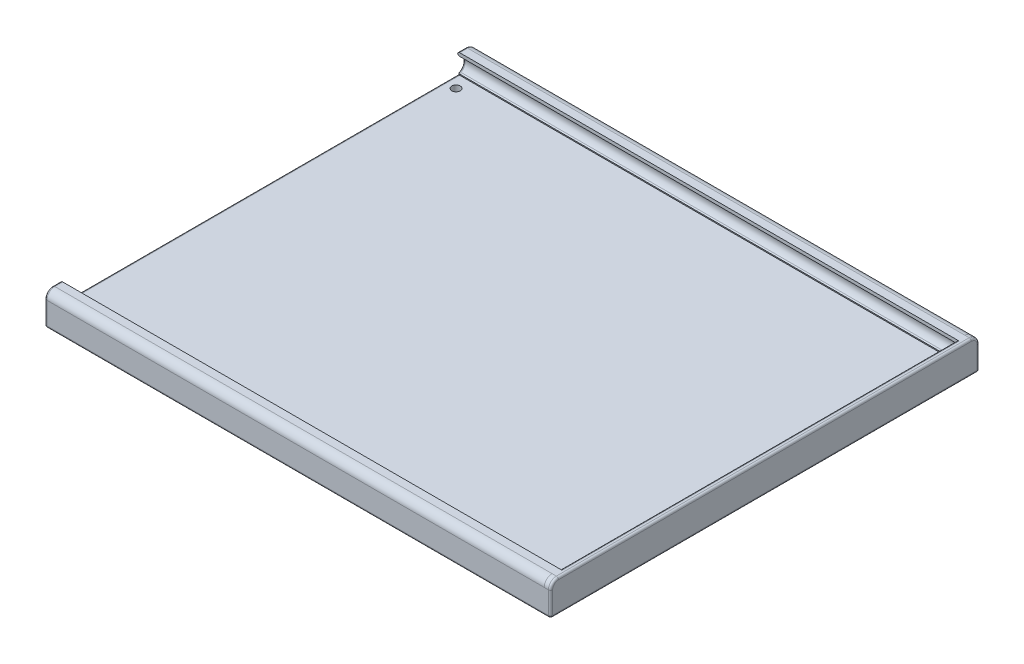
from build123d import *

# Parameters (mm, degrees)
SKETCH_1_W                         = 189.2
SKETCH_1_H                         = 149.2
EXTRUDE_184_4_144_4_24_DEPTH       = 24
SKETCH_2_W                         = 184.4
SKETCH_2_H                         = 144.4
CUT_EXTRUDE_181_2_141_2_22_4_DEPTH = 22.4
EXTRUDE_972_DEPTH                  = 189.2
EXTRUDE_1201_DEPTH                 = 189.2
SKETCH_11_W                        = 189.2
SKETCH_11_H                        = 16
EXTRUDE_0_6_DEPTH                  = 0.6
PATTERN_LINEAR_4_COUNT             = 2
PATTERN_LINEAR_4_PITCH             = 149.8
SKETCH_13_W                        = 189.2
SKETCH_13_H                        = 15
EXTRUDE_1758_DEPTH                 = 6
PATTERN_LINEAR_5_COUNT             = 2
PATTERN_LINEAR_5_PITCH             = 156.4
CUT_EXTRUDE_2280_DEPTH             = 209.269152781
CUT_EXTRUDE_2280_DEPTH_BACK        = 189.2
CUT_EXTRUDE_START                  = -189.2
CUT_EXTRUDE_2756_DEPTH             = 189.2
FILLET_3_R                         = 3
FILLET_5_R                         = 5
SKETCH_18_W                        = 162.4
SKETCH_18_H                        = 23.4
EXTRUDE_4517_DEPTH                 = 2.4
SKETCH_20_W                        = 42.4
SKETCH_20_H                        = 11
CUT_EXTRUDE_5_DEPTH                = 2.4
SKETCH_21_W                        = 0.6
SKETCH_21_H                        = 52.4
CUT_EXTRUDE_6_DEPTH                = 13
SKETCH_24_W                        = 191.218678314
SKETCH_24_H                        = 37.433567077
CUT_EXTRUDE_8_DEPTH                = 203.6
SKETCH_25_W                        = 191.6
SKETCH_25_H                        = 162.4
EXTRUDE_2_DEPTH                    = 3.2
FILLET_23_R                        = 3
FILLET_16_R                        = 0.8
FILLET_25_R                        = 0.8
SKETCH_26_R                        = 1.6
CUT_EXTRUDE_9_DEPTH                = 10
SKETCH_27_R                        = 1.75
CUT_EXTRUDE_10_DEPTH               = 15


# Read off the part's stored shape, not the designer's step: правый паз
with BuildPart() as part:
    # Эскиз1 → внешний 184,4 х 144,4 х 24 (new body)
    with BuildSketch(Plane(origin=(0, 0, 0), x_dir=(1, 0, 0), z_dir=(0, 1, 0))):
        Rectangle(SKETCH_1_W, SKETCH_1_H)
    extrude(amount=EXTRUDE_184_4_144_4_24_DEPTH)

    # Эскиз2 → внутр размер  181,2 х 141,2 х 22,4 (cut)
    with BuildSketch(Plane(origin=(0, 0, 0), x_dir=(-1, 0, 0), z_dir=(0, -1, 0))):
        Rectangle(SKETCH_2_W, SKETCH_2_H)
    extrude(amount=-CUT_EXTRUDE_181_2_141_2_22_4_DEPTH, mode=Mode.SUBTRACT)

    # Эскиз5 → Extrude 972 (add)
    with BuildSketch(Plane(origin=(94.6, 0, 0), x_dir=(0, 0, -1), z_dir=(1, 0, 0))):
        Polygon((74.6, 0), (79.6, 2.886751346), (74.6, 5.773502692), align=None)
    extrude(amount=-EXTRUDE_972_DEPTH)

    # Эскиз4 → Extrude 1201 (add)
    with BuildSketch(Plane(origin=(94.6, 0, 0), x_dir=(0, 0, -1), z_dir=(1, 0, 0))):
        Polygon((-74.6, 0), (-79.6, 2.886751346), (-74.6, 5.773502692), align=None)
    extrude(amount=-EXTRUDE_1201_DEPTH)

    # Эскиз11 → проставка 0,6 мм (add)
    with BuildSketch(Plane(origin=(0, 0, -74.6), x_dir=(-1, 0, 0), z_dir=(0, 0, -1))):
        with Locations((0, 16)):
            Rectangle(SKETCH_11_W, SKETCH_11_H)
    extrude_0_6 = extrude(amount=EXTRUDE_0_6_DEPTH)

    # Линейный массив4: проставка 0,6 мм ×2
    with Locations(*[(0, 0, i * PATTERN_LINEAR_4_PITCH) for i in range(1, PATTERN_LINEAR_4_COUNT)]):
        add(extrude_0_6)

    # Эскиз13 → Extrude 1758 (add)
    with BuildSketch(Plane(origin=(0, 0, -75.2), x_dir=(-1, 0, 0), z_dir=(0, 0, -1))):
        with Locations((0, 23.9)):
            Rectangle(SKETCH_13_W, SKETCH_13_H)
    extrude_1758 = extrude(amount=EXTRUDE_1758_DEPTH)

    # Линейный массив5: Extrude 1758 ×2
    with Locations(*[(0, 0, i * PATTERN_LINEAR_5_PITCH) for i in range(1, PATTERN_LINEAR_5_COUNT)]):
        add(extrude_1758)

    # Эскиз14 → Cut-Extrude 2280 (cut, two sides: drawn at the far end of the back side and taken through both)
    with BuildSketch(Plane(origin=(94.6, 0, 0), x_dir=(0, 0, -1), z_dir=(1, 0, 0)).offset(-CUT_EXTRUDE_2280_DEPTH_BACK)):
        Polygon((75.2, 30.173502692), (75.2, 24.4), (80.2, 27.286751346), align=None)
    extrude(amount=CUT_EXTRUDE_2280_DEPTH + CUT_EXTRUDE_2280_DEPTH_BACK, mode=Mode.SUBTRACT)

    # Cut-Extrude 2756 outline → Cut-Extrude 2756 (cut)
    with BuildSketch(Plane(origin=(94.6, 0, 0), x_dir=(0, 0, -1), z_dir=(1, 0, 0)).offset(CUT_EXTRUDE_START)):
        Polygon((-75.2, 24.4), (-75.2, 30.173502692), (-80.2, 27.286751346), align=None)
    extrude(amount=CUT_EXTRUDE_2756_DEPTH, mode=Mode.SUBTRACT)

    # Скругление 3 мм
    fillet_3_edges = [part.edges().sort_by_distance(p)[0] for p in [
        (0, 27.286751346, -80.2),
        (0, 27.286751346, 80.2),
        (0, 2.886751346, -79.6),
        (0, 2.886751346, 79.6),
        (0, 16.4, -75.2),
        (0, 31.4, -81.2),
        (0, 16.4, 75.2),
        (0, 31.4, 81.2),
    ]]
    fillet(fillet_3_edges, radius=FILLET_3_R)

    # Скругление 5 мм
    fillet_5_edges = [part.edges().sort_by_distance(p)[0] for p in [
        (0, 16.4, -81.2),
    ]]
    fillet(fillet_5_edges, radius=FILLET_5_R)

    # Эскиз18 → Extrude 4517 (add)
    with BuildSketch(Plane(origin=(94.6, 0, 0), x_dir=(0, 0, -1), z_dir=(1, 0, 0))):
        with Locations((0, 19.7)):
            Rectangle(SKETCH_18_W, SKETCH_18_H)
    extrude(amount=EXTRUDE_4517_DEPTH)

    # Эскиз20 → Вырез-Вытянуть5 (cut)
    with BuildSketch(Plane(origin=(97, 0, 0), x_dir=(0, 0, -1), z_dir=(1, 0, 0))):
        with Locations((0, 13.5)):
            Rectangle(SKETCH_20_W, SKETCH_20_H)
    extrude(amount=-CUT_EXTRUDE_5_DEPTH, mode=Mode.SUBTRACT)

    # Эскиз21 → Вырез-Вытянуть6 (cut)
    with BuildSketch(Plane.XZ.offset(-8)):
        with Locations((94.9, 0)):
            Rectangle(SKETCH_21_W, SKETCH_21_H)
    extrude(amount=-CUT_EXTRUDE_6_DEPTH, mode=Mode.SUBTRACT)

    # Эскиз24 → Вырез-Вытянуть8 (cut)
    with BuildSketch(Plane.ZY.offset(94.6)):
        with Locations((-2.778384041, 3.683216462)):
            Rectangle(SKETCH_24_W, SKETCH_24_H)
    extrude(amount=-CUT_EXTRUDE_8_DEPTH, mode=Mode.SUBTRACT)

    # Эскиз25 → Бобышка-Вытянуть2 (add)
    with BuildSketch(Plane.XZ.offset(-22.4)):
        with Locations((1.2, 0)):
            Rectangle(SKETCH_25_W, SKETCH_25_H)
    extrude(amount=EXTRUDE_2_DEPTH)

    # Скругление23
    fillet_23_edges = [part.edges().sort_by_distance(p)[0] for p in [
        (95.8, 31.4, -81.2),
        (95.8, 31.4, 81.2),
    ]]
    fillet(fillet_23_edges, radius=FILLET_23_R)

    # Скругление16
    fillet_16_edges = [part.edges().sort_by_distance(p)[0] for p in [
        (94.6, 31.4, 0),
        (97, 23.8, -81.2),
        (97, 19.2, 0),
        (97, 31.4, 0),
        (97, 23.8, 81.2),
        (97, 30.521320344, 80.321320344),
        (97, 30.521320344, -80.321320344),
    ]]
    fillet(fillet_16_edges, radius=FILLET_16_R)

    # Скругление25
    # the kernel refuses this fillet: 0.8 mm, written as the material it takes off along each edge
    with BuildSketch(Plane(origin=(96.2, 20, -80.4), x_dir=(0, -1, 0), z_dir=(0, 0, -1))) as fillet_25_piece_1_section:
        Polygon((0, 0), (FILLET_25_R * 1.02, 0), (FILLET_25_R * 1.02, -FILLET_25_R * 1.02), (0, -FILLET_25_R * 1.02), align=None)
    fillet_25_piece_1 = extrude(amount=FILLET_25_R * 1.02, mode=Mode.PRIVATE)
    fillet_25_piece_1 = fillet_25_piece_1 - Plane(origin=(96.2, 20, -80.4), x_dir=(-0.7071067811865475, 0.7071067811865475, 0), z_dir=(0, 0, -1)) * Sphere(FILLET_25_R, mode=Mode.PRIVATE)
    add(fillet_25_piece_1, mode=Mode.SUBTRACT)
    with BuildSketch(Plane(origin=(96.2, 20, 80.4), x_dir=(0, -1, 0), z_dir=(0, 0, 1))) as fillet_25_piece_2_section:
        Polygon((0, 0), (FILLET_25_R * 1.02, 0), (FILLET_25_R * 1.02, FILLET_25_R * 1.02), (0, FILLET_25_R * 1.02), align=None)
    fillet_25_piece_2 = extrude(amount=FILLET_25_R * 1.02, mode=Mode.PRIVATE)
    fillet_25_piece_2 = fillet_25_piece_2 - Plane(origin=(96.2, 20, 80.4), x_dir=(-0.7071067811865475, 0.7071067811865475, 0), z_dir=(0, 0, 1)) * Sphere(FILLET_25_R, mode=Mode.PRIVATE)
    add(fillet_25_piece_2, mode=Mode.SUBTRACT)
    with BuildSketch(Plane(origin=(-93.8, 20, -80.4), x_dir=(-1, 0, 0), z_dir=(0, 0, -1))) as fillet_25_piece_3_section:
        Polygon((0, 0), (FILLET_25_R * 1.02, 0), (FILLET_25_R * 1.02, -FILLET_25_R * 1.02), (0, -FILLET_25_R * 1.02), align=None)
    fillet_25_piece_3 = extrude(amount=FILLET_25_R * 1.02, mode=Mode.PRIVATE)
    fillet_25_piece_3 = fillet_25_piece_3 - Plane(origin=(-93.8, 20, -80.4), x_dir=(0.7071067811865475, 0.7071067811865475, 0), z_dir=(0, 0, -1)) * Sphere(FILLET_25_R, mode=Mode.PRIVATE)
    add(fillet_25_piece_3, mode=Mode.SUBTRACT)
    with BuildSketch(Plane(origin=(-93.8, 20, 80.4), x_dir=(0, -1, 0), z_dir=(0, 0, 1))) as fillet_25_piece_4_section:
        Polygon((0, 0), (FILLET_25_R * 1.02, 0), (FILLET_25_R * 1.02, -FILLET_25_R * 1.02), (0, -FILLET_25_R * 1.02), align=None)
    fillet_25_piece_4 = extrude(amount=FILLET_25_R * 1.02, mode=Mode.PRIVATE)
    fillet_25_piece_4 = fillet_25_piece_4 - Plane(origin=(-93.8, 20, 80.4), x_dir=(0.7071067811865475, 0.7071067811865475, 0), z_dir=(0, 0, 1)) * Sphere(FILLET_25_R, mode=Mode.PRIVATE)
    add(fillet_25_piece_4, mode=Mode.SUBTRACT)
    with BuildSketch(Plane(origin=(-94.6, 24, 75.2), x_dir=(0, -1, 0), z_dir=(0, 0, -1))) as fillet_25_piece_5:
        with BuildLine():
            CenterArc((FILLET_25_R, -FILLET_25_R), FILLET_25_R, 90, 90)
            Line((0, -FILLET_25_R), (-FILLET_25_R * 0.02, -FILLET_25_R))
            Line((-FILLET_25_R * 0.02, -FILLET_25_R), (-FILLET_25_R * 0.02, FILLET_25_R * 0.02))
            Line((-FILLET_25_R * 0.02, FILLET_25_R * 0.02), (FILLET_25_R, FILLET_25_R * 0.02))
            Line((FILLET_25_R, FILLET_25_R * 0.02), (FILLET_25_R, 0))
        make_face()
    extrude(amount=150.4, mode=Mode.SUBTRACT)
    with BuildSketch(Plane(origin=(-94.6, 29.884827557, -75.7), x_dir=(0, 0.8660254037844402, -0.4999999999999975), z_dir=(0, 0.4999999999999975, 0.8660254037844402))) as fillet_25_piece_6_section:
        with BuildLine():
            CenterArc((FILLET_25_R, -FILLET_25_R), FILLET_25_R, 90, 90)
            Line((0, -FILLET_25_R), (-FILLET_25_R * 0.02, -FILLET_25_R))
            Line((-FILLET_25_R * 0.02, -FILLET_25_R), (-FILLET_25_R * 0.02, FILLET_25_R * 0.02))
            Line((-FILLET_25_R * 0.02, FILLET_25_R * 0.02), (FILLET_25_R, FILLET_25_R * 0.02))
            Line((FILLET_25_R, FILLET_25_R * 0.02), (FILLET_25_R, 0))
        make_face()
    fillet_25_piece_6 = extrude(amount=2.577350269, mode=Mode.PRIVATE)
    fillet_25_piece_6 = split(fillet_25_piece_6, bisect_by=Plane(origin=(-94.433761612, 30.237602943, -75.2), z_dir=(0, 0, -1)), keep=Keep.TOP, mode=Mode.PRIVATE)
    add(fillet_25_piece_6, mode=Mode.SUBTRACT)
    with BuildSketch(Plane(origin=(-94.6, 31.173502692, 73.467949192), x_dir=(0, 0.8660254037805483, 0.5000000000067384), z_dir=(0, -0.5000000000067384, 0.8660254037805484))) as fillet_25_piece_7_section:
        with BuildLine():
            CenterArc((FILLET_25_R, -FILLET_25_R), FILLET_25_R, 90, 90)
            Line((0, -FILLET_25_R), (-FILLET_25_R * 0.02, -FILLET_25_R))
            Line((-FILLET_25_R * 0.02, -FILLET_25_R), (-FILLET_25_R * 0.02, FILLET_25_R * 0.02))
            Line((-FILLET_25_R * 0.02, FILLET_25_R * 0.02), (FILLET_25_R, FILLET_25_R * 0.02))
            Line((FILLET_25_R, FILLET_25_R * 0.02), (FILLET_25_R, 0))
        make_face()
    fillet_25_piece_7 = extrude(amount=2.577350269, mode=Mode.PRIVATE)
    fillet_25_piece_7 = split(fillet_25_piece_7, bisect_by=Plane(origin=(-94.433761612, 30.237602943, 75.2), z_dir=(0, 0, 1)), keep=Keep.TOP, mode=Mode.PRIVATE)
    add(fillet_25_piece_7, mode=Mode.SUBTRACT)
    with BuildSketch(Plane(origin=(-94.6, 24.688675135, 75.7), x_dir=(0, -0.8660254037805483, 0.5000000000067384), z_dir=(0, -0.5000000000067384, -0.8660254037805484))) as fillet_25_piece_8_section:
        with BuildLine():
            CenterArc((FILLET_25_R, -FILLET_25_R), FILLET_25_R, 90, 90)
            Line((0, -FILLET_25_R), (-FILLET_25_R * 0.02, -FILLET_25_R))
            Line((-FILLET_25_R * 0.02, -FILLET_25_R), (-FILLET_25_R * 0.02, FILLET_25_R * 0.02))
            Line((-FILLET_25_R * 0.02, FILLET_25_R * 0.02), (FILLET_25_R, FILLET_25_R * 0.02))
            Line((FILLET_25_R, FILLET_25_R * 0.02), (FILLET_25_R, 0))
        make_face()
    fillet_25_piece_8 = extrude(amount=2.577350269, mode=Mode.PRIVATE)
    fillet_25_piece_8 = split(fillet_25_piece_8, bisect_by=Plane(origin=(-94.433761612, 24.335899749, 75.2), z_dir=(0, 0, 1)), keep=Keep.TOP, mode=Mode.PRIVATE)
    add(fillet_25_piece_8, mode=Mode.SUBTRACT)
    with BuildSketch(Plane(origin=(-94.6, 23.4, -73.467949192), x_dir=(0, -0.8660254037844398, -0.499999999999998), z_dir=(0, 0.49999999999999795, -0.8660254037844398))) as fillet_25_piece_9_section:
        with BuildLine():
            CenterArc((FILLET_25_R, -FILLET_25_R), FILLET_25_R, 90, 90)
            Line((0, -FILLET_25_R), (-FILLET_25_R * 0.02, -FILLET_25_R))
            Line((-FILLET_25_R * 0.02, -FILLET_25_R), (-FILLET_25_R * 0.02, FILLET_25_R * 0.02))
            Line((-FILLET_25_R * 0.02, FILLET_25_R * 0.02), (FILLET_25_R, FILLET_25_R * 0.02))
            Line((FILLET_25_R, FILLET_25_R * 0.02), (FILLET_25_R, 0))
        make_face()
    fillet_25_piece_9 = extrude(amount=2.577350269, mode=Mode.PRIVATE)
    fillet_25_piece_9 = split(fillet_25_piece_9, bisect_by=Plane(origin=(-94.433761612, 24.335899749, -75.2), z_dir=(0, 0, -1)), keep=Keep.TOP, mode=Mode.PRIVATE)
    add(fillet_25_piece_9, mode=Mode.SUBTRACT)
    with BuildSketch(Plane(origin=(-94.6, 31.4, -75.2), x_dir=(0, -1, 0), z_dir=(0, 0, -1)), Plane(origin=(-94.6, 31.4, 78.2), x_dir=(0, -1, 0), z_dir=(0, 0, -1))) as fillet_25_piece_10:
        with BuildLine():
            CenterArc((FILLET_25_R, -FILLET_25_R), FILLET_25_R, 90, 90)
            Line((0, -FILLET_25_R), (-FILLET_25_R * 0.02, -FILLET_25_R))
            Line((-FILLET_25_R * 0.02, -FILLET_25_R), (-FILLET_25_R * 0.02, FILLET_25_R * 0.02))
            Line((-FILLET_25_R * 0.02, FILLET_25_R * 0.02), (FILLET_25_R, FILLET_25_R * 0.02))
            Line((FILLET_25_R, FILLET_25_R * 0.02), (FILLET_25_R, 0))
        make_face()
    extrude(amount=3, mode=Mode.SUBTRACT)
    with BuildSketch(Plane(origin=(-94.6, 28.4, -78.2), x_dir=(0, 1, 0), z_dir=(0, 0, 1))) as fillet_25_piece_11:
        with BuildLine():
            CenterArc((3 - FILLET_25_R, -FILLET_25_R), FILLET_25_R, 0, 90)
            Line((3, -FILLET_25_R), (3 + FILLET_25_R * 0.02, -FILLET_25_R))
            Line((3 + FILLET_25_R * 0.02, -FILLET_25_R), (3 + FILLET_25_R * 0.02, FILLET_25_R * 0.02))
            Line((3 + FILLET_25_R * 0.02, FILLET_25_R * 0.02), (3 - FILLET_25_R, FILLET_25_R * 0.02))
            Line((3 - FILLET_25_R, FILLET_25_R * 0.02), (3 - FILLET_25_R, 0))
        make_face()
    revolve(axis=Axis((-94.6, 28.4, -78.2), (-1, 0, 0)), revolution_arc=90, mode=Mode.SUBTRACT)
    with BuildSketch(Plane(origin=(-94.6, 28.4, 78.2), x_dir=(0, 0, 1), z_dir=(0, -1, 0))) as fillet_25_piece_12:
        with BuildLine():
            CenterArc((3 - FILLET_25_R, -FILLET_25_R), FILLET_25_R, 0, 90)
            Line((3, -FILLET_25_R), (3 + FILLET_25_R * 0.02, -FILLET_25_R))
            Line((3 + FILLET_25_R * 0.02, -FILLET_25_R), (3 + FILLET_25_R * 0.02, FILLET_25_R * 0.02))
            Line((3 + FILLET_25_R * 0.02, FILLET_25_R * 0.02), (3 - FILLET_25_R, FILLET_25_R * 0.02))
            Line((3 - FILLET_25_R, FILLET_25_R * 0.02), (3 - FILLET_25_R, 0))
        make_face()
    revolve(axis=Axis((-94.6, 28.4, 78.2), (-1, 0, 0)), revolution_arc=90, mode=Mode.SUBTRACT)
    with BuildSketch(Plane(origin=(-94.6, 27.286751346, 74.2), x_dir=(0, 0.866025403780547, 0.5000000000067405), z_dir=(0, 0.5000000000067405, -0.866025403780547))) as fillet_25_piece_13:
        with BuildLine():
            CenterArc((3 + FILLET_25_R, FILLET_25_R), FILLET_25_R, 180, 90)
            Line((3, FILLET_25_R), (3 - FILLET_25_R * 0.02, FILLET_25_R))
            Line((3 - FILLET_25_R * 0.02, FILLET_25_R), (3 - FILLET_25_R * 0.02, -FILLET_25_R * 0.02))
            Line((3 - FILLET_25_R * 0.02, -FILLET_25_R * 0.02), (3 + FILLET_25_R, -FILLET_25_R * 0.02))
            Line((3 + FILLET_25_R, -FILLET_25_R * 0.02), (3 + FILLET_25_R, 0))
        make_face()
    revolve(axis=Axis((-94.6, 27.286751346, 74.2), (1, 0, 0)), revolution_arc=119.999999999, mode=Mode.SUBTRACT)
    with BuildSketch(Plane(origin=(-94.6, 27.286751346, -74.2), x_dir=(0, -0.8660254037844387, -0.5), z_dir=(0, -0.5, 0.8660254037844387))) as fillet_25_piece_14:
        with BuildLine():
            CenterArc((3 + FILLET_25_R, FILLET_25_R), FILLET_25_R, 180, 90)
            Line((3, FILLET_25_R), (3 - FILLET_25_R * 0.02, FILLET_25_R))
            Line((3 - FILLET_25_R * 0.02, FILLET_25_R), (3 - FILLET_25_R * 0.02, -FILLET_25_R * 0.02))
            Line((3 - FILLET_25_R * 0.02, -FILLET_25_R * 0.02), (3 + FILLET_25_R, -FILLET_25_R * 0.02))
            Line((3 + FILLET_25_R, -FILLET_25_R * 0.02), (3 + FILLET_25_R, 0))
        make_face()
    revolve(axis=Axis((-94.6, 27.286751346, -74.2), (1, 0, 0)), revolution_arc=120, mode=Mode.SUBTRACT)
    with BuildSketch(Plane(origin=(-94.6, 28.4, -81.2), x_dir=(1, 0, 0), z_dir=(0, -1, 0))) as fillet_25_piece_15:
        with BuildLine():
            CenterArc((FILLET_25_R, FILLET_25_R), FILLET_25_R, 180, 90)
            Line((0, FILLET_25_R), (-FILLET_25_R * 0.02, FILLET_25_R))
            Line((-FILLET_25_R * 0.02, FILLET_25_R), (-FILLET_25_R * 0.02, -FILLET_25_R * 0.02))
            Line((-FILLET_25_R * 0.02, -FILLET_25_R * 0.02), (FILLET_25_R, -FILLET_25_R * 0.02))
            Line((FILLET_25_R, -FILLET_25_R * 0.02), (FILLET_25_R, 0))
        make_face()
    extrude(amount=8.4, mode=Mode.SUBTRACT)
    with BuildSketch(Plane(origin=(-94.6, 19.2, 80.4), x_dir=(0, 1, 0), z_dir=(0, 0, -1))) as fillet_25_piece_16:
        with BuildLine():
            CenterArc((FILLET_25_R, FILLET_25_R), FILLET_25_R, 180, 90)
            Line((0, FILLET_25_R), (-FILLET_25_R * 0.02, FILLET_25_R))
            Line((-FILLET_25_R * 0.02, FILLET_25_R), (-FILLET_25_R * 0.02, -FILLET_25_R * 0.02))
            Line((-FILLET_25_R * 0.02, -FILLET_25_R * 0.02), (FILLET_25_R, -FILLET_25_R * 0.02))
            Line((FILLET_25_R, -FILLET_25_R * 0.02), (FILLET_25_R, 0))
        make_face()
    extrude(amount=160.8, mode=Mode.SUBTRACT)
    with BuildSketch(Plane(origin=(-93.8, 19.2, -81.2), x_dir=(0, 1, 0), z_dir=(1, 0, 0)), Plane(origin=(96.2, 19.2, 81.2), x_dir=(0, 1, 0), z_dir=(-1, 0, 0))) as fillet_25_piece_17:
        with BuildLine():
            CenterArc((FILLET_25_R, FILLET_25_R), FILLET_25_R, 180, 90)
            Line((0, FILLET_25_R), (-FILLET_25_R * 0.02, FILLET_25_R))
            Line((-FILLET_25_R * 0.02, FILLET_25_R), (-FILLET_25_R * 0.02, -FILLET_25_R * 0.02))
            Line((-FILLET_25_R * 0.02, -FILLET_25_R * 0.02), (FILLET_25_R, -FILLET_25_R * 0.02))
            Line((FILLET_25_R, -FILLET_25_R * 0.02), (FILLET_25_R, 0))
        make_face()
    extrude(amount=190, mode=Mode.SUBTRACT)
    with BuildSketch(Plane(origin=(-94.6, 24, -75.2), x_dir=(0, 0, -1), z_dir=(0, 1, 0))) as fillet_25_piece_18_section:
        with BuildLine():
            CenterArc((FILLET_25_R, -FILLET_25_R), FILLET_25_R, 90, 90)
            Line((0, -FILLET_25_R), (-FILLET_25_R * 0.02, -FILLET_25_R))
            Line((-FILLET_25_R * 0.02, -FILLET_25_R), (-FILLET_25_R * 0.02, FILLET_25_R * 0.02))
            Line((-FILLET_25_R * 0.02, FILLET_25_R * 0.02), (FILLET_25_R, FILLET_25_R * 0.02))
            Line((FILLET_25_R, FILLET_25_R * 0.02), (FILLET_25_R, 0))
        make_face()
    fillet_25_piece_18 = extrude(amount=2.4, mode=Mode.PRIVATE)
    fillet_25_piece_18 = split(fillet_25_piece_18, bisect_by=Plane(origin=(-94.438990972, 24.458690707, -75.301655286), z_dir=(0, -0.8660254037844398, -0.49999999999999795)), keep=Keep.TOP, mode=Mode.PRIVATE)
    add(fillet_25_piece_18, mode=Mode.SUBTRACT)
    with BuildSketch(Plane(origin=(-94.6, 24, 75.2), x_dir=(0, 0, 1), z_dir=(0, 1, 0))) as fillet_25_piece_19_section:
        with BuildLine():
            CenterArc((FILLET_25_R, FILLET_25_R), FILLET_25_R, 180, 90)
            Line((0, FILLET_25_R), (-FILLET_25_R * 0.02, FILLET_25_R))
            Line((-FILLET_25_R * 0.02, FILLET_25_R), (-FILLET_25_R * 0.02, -FILLET_25_R * 0.02))
            Line((-FILLET_25_R * 0.02, -FILLET_25_R * 0.02), (FILLET_25_R, -FILLET_25_R * 0.02))
            Line((FILLET_25_R, -FILLET_25_R * 0.02), (FILLET_25_R, 0))
        make_face()
    fillet_25_piece_19 = extrude(amount=2.4, mode=Mode.PRIVATE)
    fillet_25_piece_19 = split(fillet_25_piece_19, bisect_by=Plane(origin=(-94.438990972, 24.458690707, 75.301655286), z_dir=(0, -0.8660254037805485, 0.5000000000067384)), keep=Keep.TOP, mode=Mode.PRIVATE)
    add(fillet_25_piece_19, mode=Mode.SUBTRACT)
    with BuildSketch(Plane(origin=(-94.6, 20, 81.2), x_dir=(0, 0, -1), z_dir=(0, 1, 0))) as fillet_25_piece_20:
        with BuildLine():
            CenterArc((FILLET_25_R, -FILLET_25_R), FILLET_25_R, 90, 90)
            Line((0, -FILLET_25_R), (-FILLET_25_R * 0.02, -FILLET_25_R))
            Line((-FILLET_25_R * 0.02, -FILLET_25_R), (-FILLET_25_R * 0.02, FILLET_25_R * 0.02))
            Line((-FILLET_25_R * 0.02, FILLET_25_R * 0.02), (FILLET_25_R, FILLET_25_R * 0.02))
            Line((FILLET_25_R, FILLET_25_R * 0.02), (FILLET_25_R, 0))
        make_face()
    extrude(amount=8.4, mode=Mode.SUBTRACT)
    with BuildSketch(Plane(origin=(-94.6, 22, 75.2), x_dir=(0, 0, 1), z_dir=(0, 1, 0))) as fillet_25_piece_21a_section:
        with BuildLine():
            CenterArc((FILLET_25_R, FILLET_25_R), FILLET_25_R, 180, 90)
            Line((0, FILLET_25_R), (-FILLET_25_R * 0.02, FILLET_25_R))
            Line((-FILLET_25_R * 0.02, FILLET_25_R), (-FILLET_25_R * 0.02, -FILLET_25_R * 0.02))
            Line((-FILLET_25_R * 0.02, -FILLET_25_R * 0.02), (FILLET_25_R, -FILLET_25_R * 0.02))
            Line((FILLET_25_R, -FILLET_25_R * 0.02), (FILLET_25_R, 0))
        make_face()
    fillet_25_piece_21a = extrude(amount=4.4, mode=Mode.PRIVATE)
    fillet_25_piece_21a = split(fillet_25_piece_21a, bisect_by=Plane(origin=(-94.418883909, 24, 75.381116091), z_dir=(0, -1, 0)), keep=Keep.TOP, mode=Mode.PRIVATE)
    with BuildSketch(Plane(origin=(-94.6, 24, 77.2), x_dir=(0, -1, 0), z_dir=(0, 0, -1))) as fillet_25_piece_21b_section:
        with BuildLine():
            CenterArc((FILLET_25_R, -FILLET_25_R), FILLET_25_R, 90, 90)
            Line((0, -FILLET_25_R), (-FILLET_25_R * 0.02, -FILLET_25_R))
            Line((-FILLET_25_R * 0.02, -FILLET_25_R), (-FILLET_25_R * 0.02, FILLET_25_R * 0.02))
            Line((-FILLET_25_R * 0.02, FILLET_25_R * 0.02), (FILLET_25_R, FILLET_25_R * 0.02))
            Line((FILLET_25_R, FILLET_25_R * 0.02), (FILLET_25_R, 0))
        make_face()
    fillet_25_piece_21b = extrude(amount=152.4, mode=Mode.PRIVATE)
    fillet_25_piece_21b = split(fillet_25_piece_21b, bisect_by=Plane(origin=(-94.418883909, 23.818883909, 75.2), z_dir=(0, 0, 1)), keep=Keep.TOP, mode=Mode.PRIVATE)
    fillet_25_piece_21 = fillet_25_piece_21a & fillet_25_piece_21b
    add(fillet_25_piece_21, mode=Mode.SUBTRACT)
    with BuildSketch(Plane(origin=(-94.6, 24, 75.2), x_dir=(0, -1, 0), z_dir=(0, 0, -1))) as fillet_25_piece_22a_section:
        with BuildLine():
            CenterArc((FILLET_25_R, -FILLET_25_R), FILLET_25_R, 90, 90)
            Line((0, -FILLET_25_R), (-FILLET_25_R * 0.02, -FILLET_25_R))
            Line((-FILLET_25_R * 0.02, -FILLET_25_R), (-FILLET_25_R * 0.02, FILLET_25_R * 0.02))
            Line((-FILLET_25_R * 0.02, FILLET_25_R * 0.02), (FILLET_25_R, FILLET_25_R * 0.02))
            Line((FILLET_25_R, FILLET_25_R * 0.02), (FILLET_25_R, 0))
        make_face()
    fillet_25_piece_22a = extrude(amount=152.4, mode=Mode.PRIVATE)
    fillet_25_piece_22a = split(fillet_25_piece_22a, bisect_by=Plane(origin=(-94.418883909, 23.818883909, -75.2), z_dir=(0, 0, -1)), keep=Keep.TOP, mode=Mode.PRIVATE)
    with BuildSketch(Plane(origin=(-94.6, 22, -75.2), x_dir=(0, 0, -1), z_dir=(0, 1, 0))) as fillet_25_piece_22b_section:
        with BuildLine():
            CenterArc((FILLET_25_R, -FILLET_25_R), FILLET_25_R, 90, 90)
            Line((0, -FILLET_25_R), (-FILLET_25_R * 0.02, -FILLET_25_R))
            Line((-FILLET_25_R * 0.02, -FILLET_25_R), (-FILLET_25_R * 0.02, FILLET_25_R * 0.02))
            Line((-FILLET_25_R * 0.02, FILLET_25_R * 0.02), (FILLET_25_R, FILLET_25_R * 0.02))
            Line((FILLET_25_R, FILLET_25_R * 0.02), (FILLET_25_R, 0))
        make_face()
    fillet_25_piece_22b = extrude(amount=4.4, mode=Mode.PRIVATE)
    fillet_25_piece_22b = split(fillet_25_piece_22b, bisect_by=Plane(origin=(-94.418883909, 24, -75.381116091), z_dir=(0, -1, 0)), keep=Keep.TOP, mode=Mode.PRIVATE)
    fillet_25_piece_22 = fillet_25_piece_22a & fillet_25_piece_22b
    add(fillet_25_piece_22, mode=Mode.SUBTRACT)
    with BuildSketch(Plane(origin=(-94.6, 24.688675135, 75.7), x_dir=(0, -0.8660254037805483, 0.5000000000067384), z_dir=(0, -0.5000000000067384, -0.8660254037805484))) as fillet_25_piece_23a_section:
        with BuildLine():
            CenterArc((FILLET_25_R, -FILLET_25_R), FILLET_25_R, 90, 90)
            Line((0, -FILLET_25_R), (-FILLET_25_R * 0.02, -FILLET_25_R))
            Line((-FILLET_25_R * 0.02, -FILLET_25_R), (-FILLET_25_R * 0.02, FILLET_25_R * 0.02))
            Line((-FILLET_25_R * 0.02, FILLET_25_R * 0.02), (FILLET_25_R, FILLET_25_R * 0.02))
            Line((FILLET_25_R, FILLET_25_R * 0.02), (FILLET_25_R, 0))
        make_face()
    fillet_25_piece_23a = extrude(amount=2.577350269, mode=Mode.PRIVATE)
    fillet_25_piece_23a = split(fillet_25_piece_23a, bisect_by=Plane(origin=(-94.413531374, 23.726161265, 75.2), z_dir=(0, 0, -1)), keep=Keep.TOP, mode=Mode.PRIVATE)
    with BuildSketch(Plane(origin=(-94.6, 24, 75.2), x_dir=(0, 0, 1), z_dir=(0, 1, 0))) as fillet_25_piece_23b_section:
        with BuildLine():
            CenterArc((FILLET_25_R, FILLET_25_R), FILLET_25_R, 180, 90)
            Line((0, FILLET_25_R), (-FILLET_25_R * 0.02, FILLET_25_R))
            Line((-FILLET_25_R * 0.02, FILLET_25_R), (-FILLET_25_R * 0.02, -FILLET_25_R * 0.02))
            Line((-FILLET_25_R * 0.02, -FILLET_25_R * 0.02), (FILLET_25_R, -FILLET_25_R * 0.02))
            Line((FILLET_25_R, -FILLET_25_R * 0.02), (FILLET_25_R, 0))
        make_face()
    fillet_25_piece_23b = extrude(amount=2.4, mode=Mode.PRIVATE)
    fillet_25_piece_23b = split(fillet_25_piece_23b, bisect_by=Plane(origin=(-94.413531374, 24.736919367, 75.783561462), z_dir=(0, 0.8660254037805485, -0.5000000000067384)), keep=Keep.TOP, mode=Mode.PRIVATE)
    fillet_25_piece_23 = fillet_25_piece_23a & fillet_25_piece_23b
    add(fillet_25_piece_23, mode=Mode.SUBTRACT)
    with BuildSketch(Plane(origin=(-94.6, 24, -75.2), x_dir=(0, 0, -1), z_dir=(0, 1, 0))) as fillet_25_piece_24a_section:
        with BuildLine():
            CenterArc((FILLET_25_R, -FILLET_25_R), FILLET_25_R, 90, 90)
            Line((0, -FILLET_25_R), (-FILLET_25_R * 0.02, -FILLET_25_R))
            Line((-FILLET_25_R * 0.02, -FILLET_25_R), (-FILLET_25_R * 0.02, FILLET_25_R * 0.02))
            Line((-FILLET_25_R * 0.02, FILLET_25_R * 0.02), (FILLET_25_R, FILLET_25_R * 0.02))
            Line((FILLET_25_R, FILLET_25_R * 0.02), (FILLET_25_R, 0))
        make_face()
    fillet_25_piece_24a = extrude(amount=2.4, mode=Mode.PRIVATE)
    fillet_25_piece_24a = split(fillet_25_piece_24a, bisect_by=Plane(origin=(-94.413531374, 24.736919367, -75.783561462), z_dir=(0, 0.8660254037844398, 0.49999999999999795)), keep=Keep.TOP, mode=Mode.PRIVATE)
    with BuildSketch(Plane(origin=(-94.6, 23.4, -73.467949192), x_dir=(0, -0.8660254037844398, -0.499999999999998), z_dir=(0, 0.49999999999999795, -0.8660254037844398))) as fillet_25_piece_24b_section:
        with BuildLine():
            CenterArc((FILLET_25_R, -FILLET_25_R), FILLET_25_R, 90, 90)
            Line((0, -FILLET_25_R), (-FILLET_25_R * 0.02, -FILLET_25_R))
            Line((-FILLET_25_R * 0.02, -FILLET_25_R), (-FILLET_25_R * 0.02, FILLET_25_R * 0.02))
            Line((-FILLET_25_R * 0.02, FILLET_25_R * 0.02), (FILLET_25_R, FILLET_25_R * 0.02))
            Line((FILLET_25_R, FILLET_25_R * 0.02), (FILLET_25_R, 0))
        make_face()
    fillet_25_piece_24b = extrude(amount=2.577350269, mode=Mode.PRIVATE)
    fillet_25_piece_24b = split(fillet_25_piece_24b, bisect_by=Plane(origin=(-94.413531374, 23.726161265, -75.2), z_dir=(0, 0, 1)), keep=Keep.TOP, mode=Mode.PRIVATE)
    fillet_25_piece_24 = fillet_25_piece_24a & fillet_25_piece_24b
    add(fillet_25_piece_24, mode=Mode.SUBTRACT)

    # Эскиз26 → Вырез-Вытянуть9 (cut)
    with BuildSketch(Plane.XZ.offset(-19.2)):
        with Locations(Location((-90.2, -70.2, 0), (0, 0, 270))):
            Circle(SKETCH_26_R)
    extrude(amount=-CUT_EXTRUDE_9_DEPTH, mode=Mode.SUBTRACT)

    # Эскиз27 → Вырез-Вытянуть10 (cut)
    with BuildSketch(Plane.XZ.offset(-19.2)):
        with Locations(Location((90.2, 70.2, 0), (0, 0, 270))):
            Circle(SKETCH_27_R)
    extrude(amount=-CUT_EXTRUDE_10_DEPTH, mode=Mode.SUBTRACT)


solid = part.part
